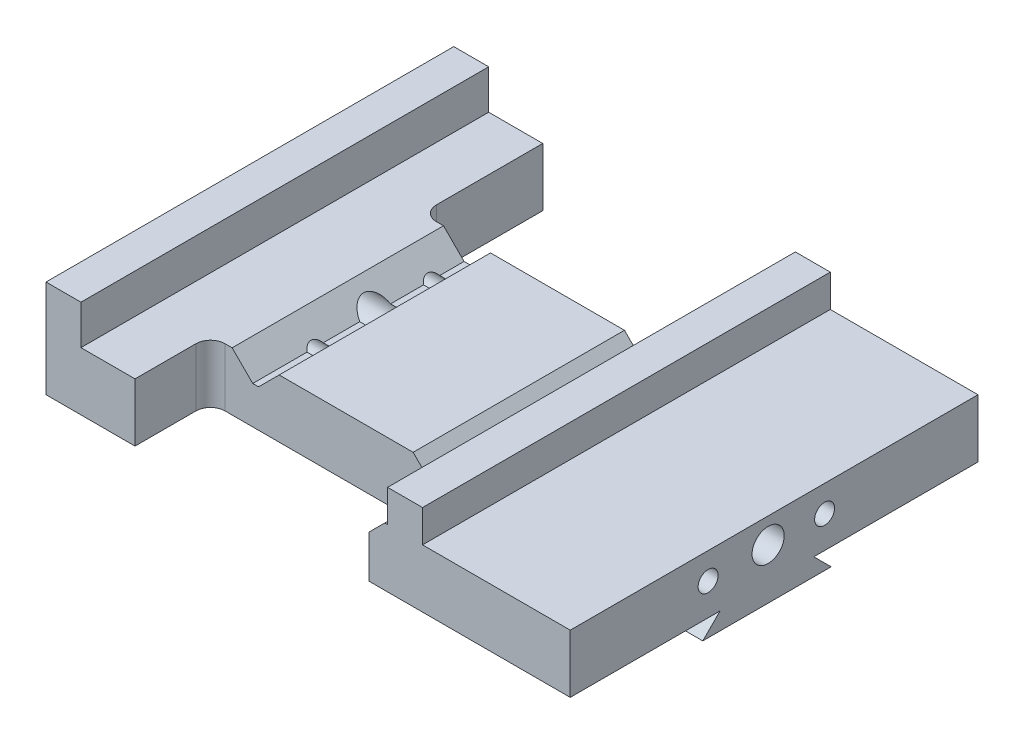
from build123d import *

# Parameters (mm, degrees)
BOSS_EXTRUDE1_DEPTH = 140
BOSS_EXTRUDE2_DEPTH = 180
CUT_EXTRUDE1_DEPTH  = 100
SKETCH4_R           = 5.519100576
CUT_EXTRUDE2_DEPTH  = 1000
SKETCH5_R           = 3.428433795
CUT_EXTRUDE3_DEPTH  = 1000


with BuildPart() as part:
    # Sketch1 → Boss-Extrude1 (new body)
    with BuildSketch(Plane.XY):
        Polygon((-151.904160434, 0.478889041), (-151.904160434, 20.590620884), (-139.904160434, 20.590620884), (-139.904160434, 7.071067812), (-113.904160434, 7.071067812), (-106.833092622, 0), (-104.833092622, 0), (-97.76202481, 7.071067812), (-51.76202481, 7.071067812), (-44.690956998, 0), (-42.690956998, 0), (-35.619889186, 7.071067812), (-34.619889186, 7.071067812), (-34.619889186, 18.180006359), (-22.619889186, 18.180006359), (-22.619889186, 7.071067812), (28.095839566, 7.071067812), (28.095839566, -12.928932188), (-151.904160434, -12.928932188), align=None)
    extrude(amount=BOSS_EXTRUDE1_DEPTH)

    # Sketch2 → Boss-Extrude2 (add)
    with BuildSketch(Plane(origin=(28.095839566, 0, 0), x_dir=(0, 0, -1), z_dir=(1, 0, 0))):
        Polygon((-88.54454788, -12.928932188), (-94.498374203, -18.882758511), (-50.409746992, -18.882758511), (-56.363573315, -12.928932188), align=None)
    extrude(amount=-BOSS_EXTRUDE2_DEPTH)

    # Sketch3 → Cut-Extrude1 (cut)
    with BuildSketch(Plane.XZ.offset(12.928932188)):
        with BuildLine():
            Line((-121.342924919, 0), (-41.039209534, 0))
            Line((-41.039209534, 0), (-41.039209534, 36.520193962))
            ThreePointArc((-41.039209534, 36.520193962), (-42.503675628, 40.055727868), (-46.039209534, 41.520193962))
            Line((-46.039209534, 41.520193962), (-116.342924919, 41.520193962))
            ThreePointArc((-116.342924919, 41.520193962), (-119.878458825, 40.055727868), (-121.342924919, 36.520193962))
            Line((-121.342924919, 36.520193962), (-121.342924919, 0))
        make_face()
        with BuildLine():
            Line((-121.342924919, 140), (-41.039209534, 140))
            Line((-41.039209534, 140), (-41.039209534, 119.087006536))
            ThreePointArc((-41.039209534, 119.087006536), (-42.503675628, 115.55147263), (-46.039209534, 114.087006536))
            Line((-46.039209534, 114.087006536), (-116.342924919, 114.087006536))
            ThreePointArc((-116.342924919, 114.087006536), (-119.878458825, 115.55147263), (-121.342924919, 119.087006536))
            Line((-121.342924919, 119.087006536), (-121.342924919, 140))
        make_face()
    extrude(amount=-CUT_EXTRUDE1_DEPTH, mode=Mode.SUBTRACT)

    # Sketch4 → Cut-Extrude2 (cut)
    with BuildSketch(Plane(origin=(28.095839566, 0, 0), x_dir=(0, 0, -1), z_dir=(1, 0, 0))):
        with Locations((-72.052487045, -1.555510128)):
            Circle(SKETCH4_R)
    extrude(amount=-CUT_EXTRUDE2_DEPTH, mode=Mode.SUBTRACT)

    # Sketch5 → Cut-Extrude3 (cut)
    with BuildSketch(Plane(origin=(28.095839566, 0, 0), x_dir=(0, 0, -1), z_dir=(1, 0, 0))):
        with Locations((-92.666596067, -2.001702964)):
            Circle(SKETCH5_R)
        with Locations((-52.666596067, -2.001702964)):
            Circle(SKETCH5_R)
    extrude(amount=-CUT_EXTRUDE3_DEPTH, mode=Mode.SUBTRACT)


solid = part.part
